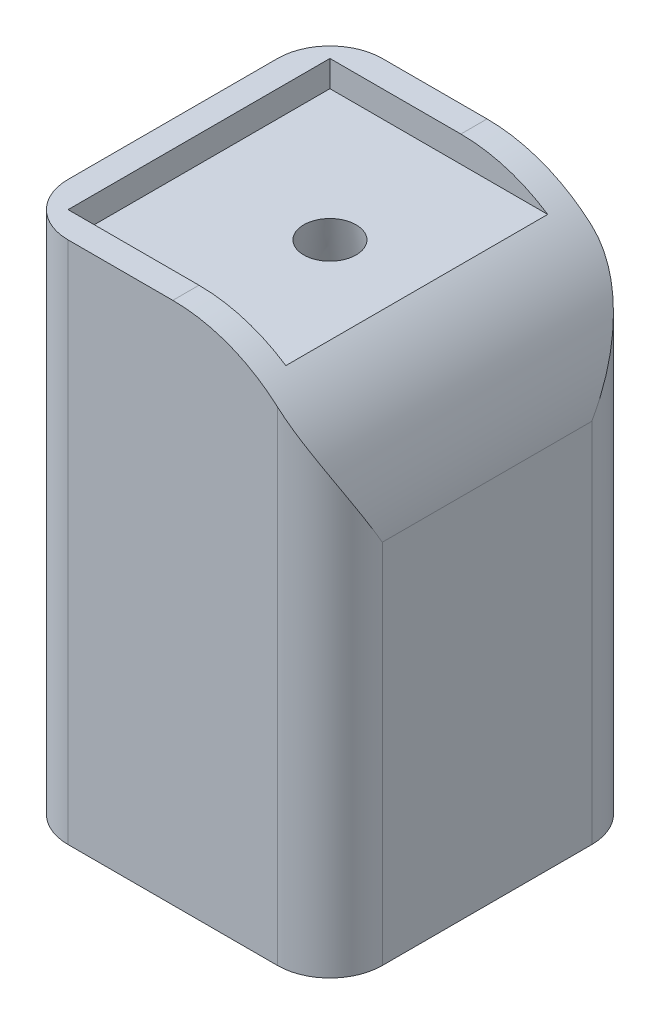
from build123d import *

# Parameters (mm, degrees)
SKETCH2_W           = 30
SKETCH2_H           = 30
BOSS_EXTRUDE1_DEPTH = 50
SKETCH3_W           = 25
SKETCH3_H           = 25
CUT_EXTRUDE1_DEPTH  = 2.5
FILLET1_R           = 5
CUT_EXTRUDE2_DEPTH  = 61.207972969


with BuildPart() as part:
    # Sketch2 → Boss-Extrude1 (new body)
    with BuildSketch(Plane(origin=(0, 0, 0), x_dir=(1, 0, 0), z_dir=(0, 1, 0))):
        Rectangle(SKETCH2_W, SKETCH2_H)
    extrude(amount=BOSS_EXTRUDE1_DEPTH)

    # Sketch3 → Cut-Extrude1 (cut)
    with BuildSketch(Plane(origin=(0, 50, 0), x_dir=(1, 0, 0), z_dir=(0, 1, 0))):
        Rectangle(SKETCH3_W, SKETCH3_H)
    extrude(amount=-CUT_EXTRUDE1_DEPTH, mode=Mode.SUBTRACT)

    # Fillet1
    fillet1_edges = [part.edges().sort_by_distance(p)[0] for p in [
        (15, 25, 15),
        (-15, 25, 15),
        (-15, 25, -15),
        (15, 25, -15),
    ]]
    fillet(fillet1_edges, radius=FILLET1_R)

    # Cut-Loft2: read off the stored shape, not the designer's step
    # Cut-Loft2: loft between two sections, ruled curve by curve
    cut_loft2_from = [
        Edge.make_bspline([(0, 0, -12.5), (-25, 0, -12.5), (-25, 0, 12.5), (0, 0, 12.5), (25, 0, 12.5), (25, 0, -12.5), (0, 0, -12.5)], [0, 0, 0, 0, 0.5, 0.5, 0.5, 1, 1, 1, 1], 3, [1, 0.333333333, 0.333333333, 1, 0.333333333, 0.333333333, 1]),
    ]
    cut_loft2_to = [
        Edge.make_bspline([(0.784484005, 47.5, -2.373728048), (-3.962972092, 47.5, -3.942696057), (-5.531940101, 47.5, 0.804760039), (-0.784484005, 47.5, 2.373728048), (3.962972092, 47.5, 3.942696057), (5.531940101, 47.5, -0.804760039), (0.784484005, 47.5, -2.373728048)], [0, 0, 0, 0, 0.5, 0.5, 0.5, 1, 1, 1, 1], 3, [1, 0.333333333, 0.333333333, 1, 0.333333333, 0.333333333, 1]),
    ]
    cut_loft2 = Solid(Shell([*[Face.make_surface_from_curves(cut_loft2_from[k], cut_loft2_to[k]) for k in range(1)], Face(Wire(cut_loft2_from)), Face(Wire(cut_loft2_to))]))
    add(cut_loft2, mode=Mode.SUBTRACT)

    # Sketch9 → Cut-Extrude2 (cut, through all)
    with BuildSketch(Plane.XY.offset(15)):
        with BuildLine():
            Line((15, 50), (10, 50))
            Line((10, 50), (10, 46.180339887))
            ThreePointArc((10, 46.180339887), (13.693063938, 41.123724357), (15, 35))
            Line((15, 35), (15, 50))
        make_face()
        with BuildLine():
            Line((10, 50), (0, 50))
            ThreePointArc((0, 50), (5.352331347, 49.012585384), (10, 46.180339887))
            Line((10, 46.180339887), (10, 50))
        make_face()
    extrude(amount=-CUT_EXTRUDE2_DEPTH, mode=Mode.SUBTRACT)


solid = part.part
